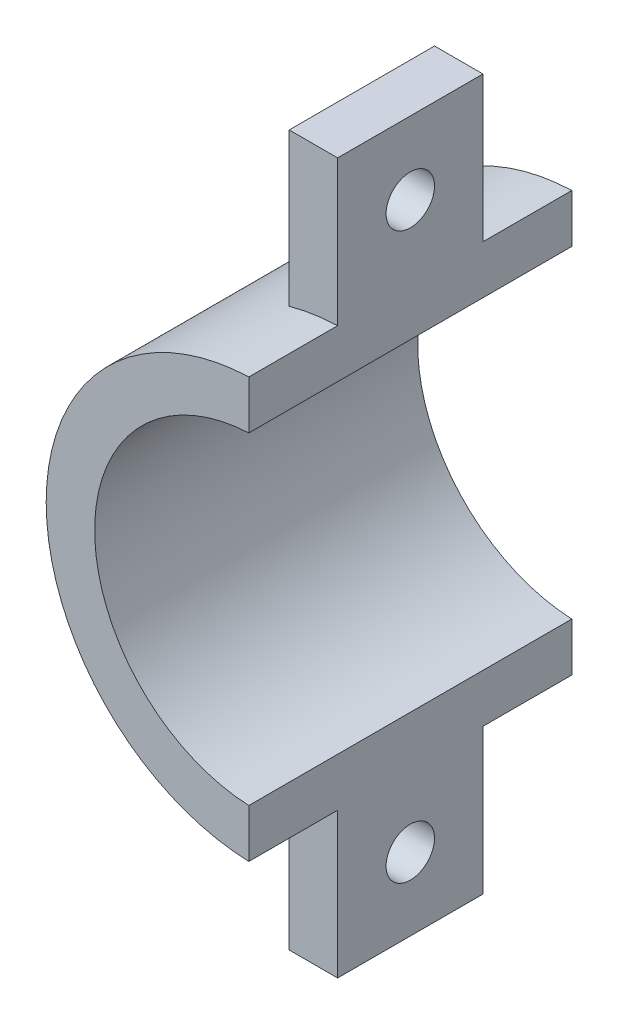
from build123d import *

# Parameters (mm, degrees)
EXTRUDE_1_DEPTH = 20
SKETCH_3_W      = 9
SKETCH_3_H      = 12
SKETCH_3_R      = 1.5
EXTRUDE_2_DEPTH = 3


with BuildPart() as part:
    # Эскиз1 → Бобышка-Вытянуть1 (new body)
    with BuildSketch(Plane.XY):
        with BuildLine():
            ThreePointArc((-0.453693457, 12.992080751), (-13, 0), (-0.453693457, -12.992080751))
            Line((-0.453693457, -12.992080751), (-0.453693457, -9.989702811))
            ThreePointArc((-0.453693457, -9.989702811), (-10, 0), (-0.453693457, 9.989702811))
            Line((-0.453693457, 9.989702811), (-0.453693457, 12.992080751))
        make_face()
    extrude(amount=EXTRUDE_1_DEPTH)

    # Эскиз3 → Бобышка-Вытянуть2 (add)
    # profile 1 of 2: a face of its own
    with BuildSketch(Plane(origin=(-0.453693457, 0, 0), x_dir=(0, 0, -1), z_dir=(1, 0, 0))):
        with Locations((-10, 15.989702811)):
            Rectangle(SKETCH_3_W, SKETCH_3_H)
        with Locations((-10, 17.489702811)):
            Circle(SKETCH_3_R, mode=Mode.SUBTRACT)
    # profile 2 of 2: a face of its own
    with BuildSketch(Plane(origin=(-0.453693457, 0, 0), x_dir=(0, 0, -1), z_dir=(1, 0, 0))):
        with Locations((-10, -15.989702811)):
            Rectangle(SKETCH_3_W, SKETCH_3_H)
        with Locations((-10, -17.489702811)):
            Circle(SKETCH_3_R, mode=Mode.SUBTRACT)
    extrude(amount=-EXTRUDE_2_DEPTH)


solid = part.part
